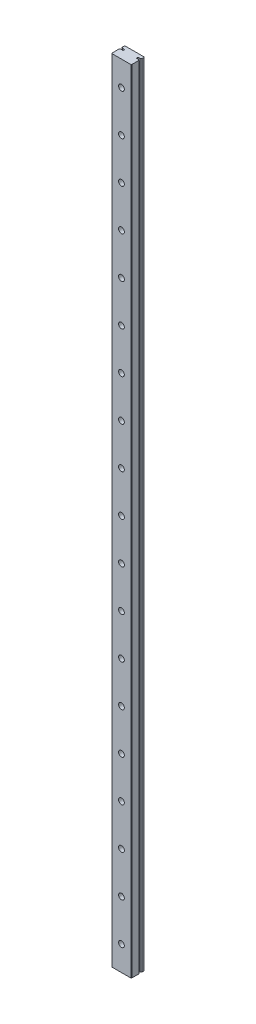
from build123d import *

# Parameters (mm, degrees)
SKETCH1_W                                        = 12
SKETCH1_H                                        = 480
BOSS_EXTRUDE1_DEPTH                              = 8
CUT_EXTRUDE1_DEPTH                               = 481.054546258
CUT_EXTRUDE2_DEPTH                               = 481.054546258
CUT_EXTRUDE3_DEPTH                               = 481.054546258
CUT_EXTRUDE4_DEPTH                               = 481.054546258
CBORE_FOR_M3_HEX_HEAD_MACHINE_SCREW1_D           = 3.5
CBORE_FOR_M3_HEX_HEAD_MACHINE_SCREW1_CBORE_D     = 6
CBORE_FOR_M3_HEX_HEAD_MACHINE_SCREW1_CBORE_DEPTH = 4.5
CHAMFER1_SIZE                                    = 0.5
CHAMFER2_SIZE                                    = 0.2977


with BuildPart() as part:
    # Sketch1 → Boss-Extrude1 (new body)
    with BuildSketch(Plane(origin=(0, 0, -4), x_dir=(-1, 0, 0), z_dir=(0, 0, -1))):
        with Locations((0.030537514, 240)):
            Rectangle(SKETCH1_W, SKETCH1_H)
    extrude(amount=-BOSS_EXTRUDE1_DEPTH)

    # Sketch2 → Cut-Extrude1 (cut, through all)
    with BuildSketch(Plane(origin=(0, 480, 0), x_dir=(-1, 0, 0), z_dir=(0, 1, 0))):
        with BuildLine():
            Line((6.030537514, -2.4577), (6.030537514, -1.0033))
            Line((6.030537514, -1.0033), (4.048874358, -1.0033))
            Line((4.048874358, -1.0033), (4.048874358, -1.9939))
            Line((4.048874358, -1.9939), (5.420474358, -1.9939))
            ThreePointArc((5.420474358, -1.9939), (5.678839101, -2.287183606), (6.030537514, -2.4577))
        make_face()
    extrude(amount=-CUT_EXTRUDE1_DEPTH, mode=Mode.SUBTRACT)

    # Sketch3 → Cut-Extrude2 (cut, through all)
    with BuildSketch(Plane(origin=(0, 480, 0), x_dir=(-1, 0, 0), z_dir=(0, 1, 0))):
        with BuildLine():
            Line((-5.969462486, -1.0033), (-5.969462486, -2.4577))
            ThreePointArc((-5.969462486, -2.4577), (-5.617764074, -2.287183606), (-5.35939933, -1.9939))
            Line((-5.35939933, -1.9939), (-3.98779933, -1.9939))
            Line((-3.98779933, -1.9939), (-3.98779933, -1.0033))
            Line((-3.98779933, -1.0033), (-5.969462486, -1.0033))
        make_face()
    extrude(amount=-CUT_EXTRUDE2_DEPTH, mode=Mode.SUBTRACT)

    # Sketch4 → Cut-Extrude3 (cut, through all)
    with BuildSketch(Plane(origin=(0, 480, 0), x_dir=(-1, 0, 0), z_dir=(0, 1, 0))):
        with BuildLine():
            Line((-5.969462486, -1.0033), (-5.35939933, -1.0033))
            ThreePointArc((-5.35939933, -1.0033), (-5.617764074, -0.710016394), (-5.969462486, -0.5395))
            Line((-5.969462486, -0.5395), (-5.969462486, -1.0033))
        make_face()
    extrude(amount=-CUT_EXTRUDE3_DEPTH, mode=Mode.SUBTRACT)

    # Sketch5 → Cut-Extrude4 (cut, through all)
    with BuildSketch(Plane(origin=(0, 480, 0), x_dir=(-1, 0, 0), z_dir=(0, 1, 0))):
        with BuildLine():
            Line((6.030537514, -1.0033), (6.030537514, -0.5395))
            ThreePointArc((6.030537514, -0.5395), (5.678839101, -0.710016394), (5.420474358, -1.0033))
            Line((5.420474358, -1.0033), (6.030537514, -1.0033))
        make_face()
    extrude(amount=-CUT_EXTRUDE4_DEPTH, mode=Mode.SUBTRACT)

    # CBORE for M3 Hex Head Machine Screw1 (through all)
    with Locations(Plane(origin=(0, 0, -4), x_dir=(-1, 0, 0), z_dir=(0, 0, -1))):
        with Locations((0, 465), (0, 440), (0, 415), (0, 390), (0, 365), (0, 340), (0, 315), (0, 290), (0, 265), (0, 240), (0, 215), (0, 190), (0, 165), (0, 140), (0, 115), (0, 90), (0, 65), (0, 40), (0, 15)):
            CounterBoreHole(CBORE_FOR_M3_HEX_HEAD_MACHINE_SCREW1_D / 2, CBORE_FOR_M3_HEX_HEAD_MACHINE_SCREW1_CBORE_D / 2, CBORE_FOR_M3_HEX_HEAD_MACHINE_SCREW1_CBORE_DEPTH)

    # Chamfer1
    chamfer1_edges = [part.edges().sort_by_distance(p)[0] for p in [
        (3, 190, -4),
        (3, 90, -4),
        (3, 240, -4),
        (3, 140, -4),
        (3, 40, -4),
        (3, 465, -4),
        (3, 265, -4),
        (3, 440, -4),
        (3, 215, -4),
        (3, 415, -4),
        (3, 165, -4),
        (3, 390, -4),
        (3, 115, -4),
        (3, 365, -4),
        (3, 65, -4),
        (3, 340, -4),
        (3, 15, -4),
        (3, 315, -4),
        (3, 290, -4),
    ]]
    chamfer(chamfer1_edges, length=CHAMFER1_SIZE)

    # Chamfer2
    chamfer2_edges = [part.edges().sort_by_distance(p)[0] for p in [
        (-6.030537514, 240, -4),
        (5.969462486, 240, -4),
        (5.969462486, 240, 4),
        (-6.030537514, 240, 4),
    ]]
    chamfer(chamfer2_edges, length=CHAMFER2_SIZE)


solid = part.part
